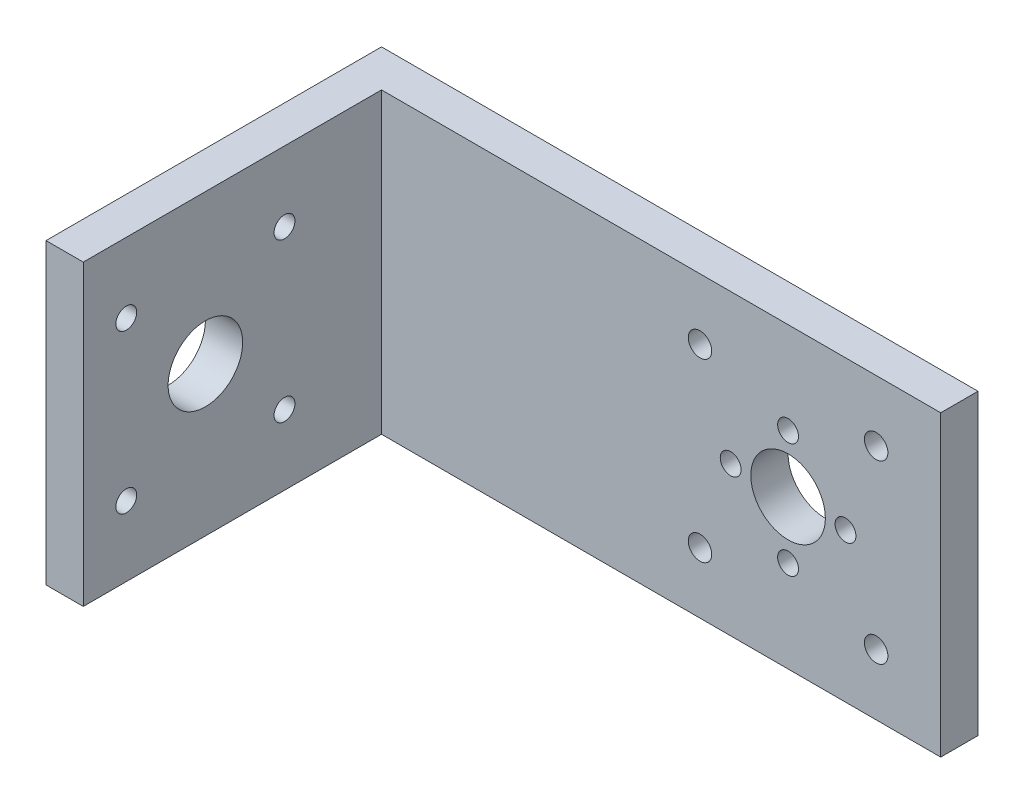
from build123d import *

# Parameters (mm, degrees)
SKETCH1_W           = 101.6
SKETCH1_H           = 50.8
BOSS_EXTRUDE1_DEPTH = 6.35
SKETCH2_R           = 2
CUT_EXTRUDE1_DEPTH  = 6.35
SKETCH3_R           = 1.778
CUT_EXTRUDE2_DEPTH  = 6.35
SKETCH4_R           = 6.35
CUT_EXTRUDE3_DEPTH  = 6.35
CIRPATTERN1_COUNT   = 4
SKETCH5_W           = 6.35
SKETCH5_H           = 50.8
BOSS_EXTRUDE2_DEPTH = 50.8
SKETCH6_R           = 6.35
CUT_EXTRUDE4_DEPTH  = 6.35
SKETCH7_R           = 1.778
CUT_EXTRUDE5_DEPTH  = 6.35
CIRPATTERN2_COUNT   = 4


with BuildPart() as part:
    # Sketch1 → Boss-Extrude1 (new body)
    with BuildSketch(Plane.XY):
        with Locations((-50.8, -25.4)):
            Rectangle(SKETCH1_W, SKETCH1_H)
    extrude(amount=BOSS_EXTRUDE1_DEPTH)

    # Sketch2 → Cut-Extrude1 (cut)
    with BuildSketch(Plane.XY.offset(6.35)):
        with Locations((-11, -10.400000028)):
            Circle(SKETCH2_R)
        with Locations((-41, -10.400000028)):
            Circle(SKETCH2_R)
        with Locations((-41, -40.399999972)):
            Circle(SKETCH2_R)
        with Locations((-11, -40.399999972)):
            Circle(SKETCH2_R)
    extrude(amount=-CUT_EXTRUDE1_DEPTH, mode=Mode.SUBTRACT)

    # Sketch3 → Cut-Extrude2 (cut)
    with BuildSketch(Plane.XY.offset(6.35)):
        with Locations((-26, -15.621)):
            Circle(SKETCH3_R)
    cut_extrude2 = extrude(amount=-CUT_EXTRUDE2_DEPTH, mode=Mode.SUBTRACT)

    # Sketch4 → Cut-Extrude3 (cut)
    with BuildSketch(Plane.XY.offset(6.35)):
        with Locations((-26, -25.4)):
            Circle(SKETCH4_R)
    extrude(amount=-CUT_EXTRUDE3_DEPTH, mode=Mode.SUBTRACT)

    # CirPattern1: Cut-Extrude2 ×4 about axis
    cirpattern1_axis = Axis((-26, -25.4, 6.35), (0, 0, 1))
    for i in range(1, CIRPATTERN1_COUNT):
        add(cut_extrude2.rotate(cirpattern1_axis, i * 360 / CIRPATTERN1_COUNT), mode=Mode.SUBTRACT)

    # Sketch5 → Boss-Extrude2 (add)
    with BuildSketch(Plane.XY.offset(6.35)):
        with Locations((-98.425, -25.4)):
            Rectangle(SKETCH5_W, SKETCH5_H)
    extrude(amount=BOSS_EXTRUDE2_DEPTH)

    # Sketch6 → Cut-Extrude4 (cut)
    with BuildSketch(Plane(origin=(-95.25, 0, 0), x_dir=(0, 0, -1), z_dir=(1, 0, 0))):
        with Locations((-36.35, -25.4)):
            Circle(SKETCH6_R)
    extrude(amount=-CUT_EXTRUDE4_DEPTH, mode=Mode.SUBTRACT)

    # Sketch7 → Cut-Extrude5 (cut)
    with BuildSketch(Plane(origin=(-95.25, 0, 0), x_dir=(0, 0, -1), z_dir=(1, 0, 0))):
        with Locations((-49.8247, -11.9253)):
            Circle(SKETCH7_R)
    cut_extrude5 = extrude(amount=-CUT_EXTRUDE5_DEPTH, mode=Mode.SUBTRACT)

    # CirPattern2: Cut-Extrude5 ×4 about axis
    cirpattern2_axis = Axis((-95.25, -25.4, 36.35), (1, 0, 0))
    for i in range(1, CIRPATTERN2_COUNT):
        add(cut_extrude5.rotate(cirpattern2_axis, i * 360 / CIRPATTERN2_COUNT), mode=Mode.SUBTRACT)


solid = part.part
